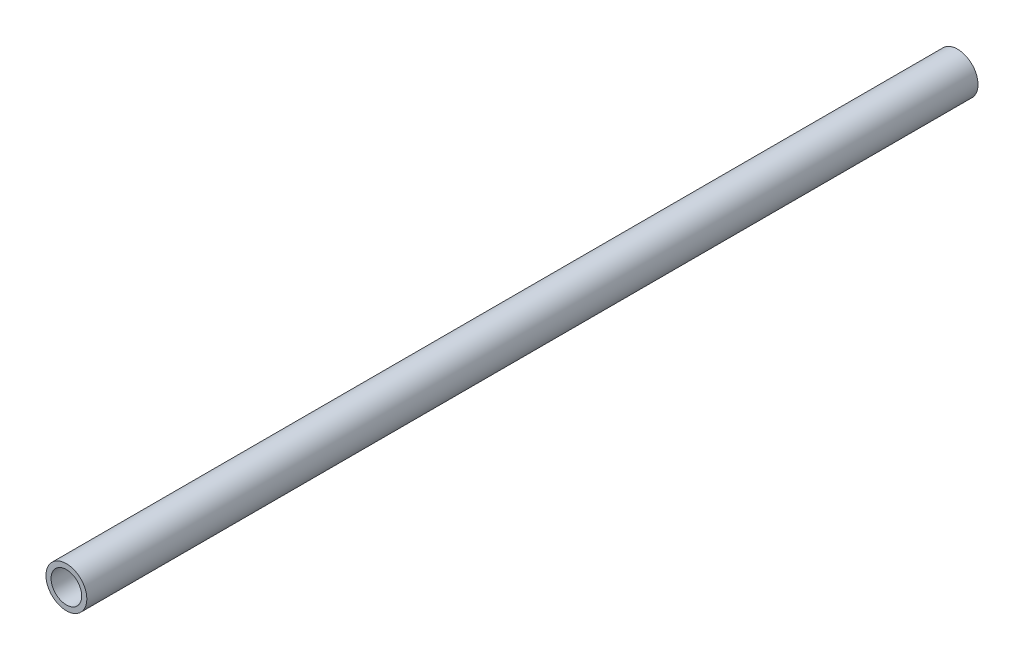
from build123d import *

# Parameters (mm, degrees)
SKETCH2_R           = 12.7
SKETCH2_R_2         = 9.525
BOSS_EXTRUDE1_DEPTH = 277.00605


with BuildPart() as part:
    # Sketch2 → Boss-Extrude1 (new, symmetric)
    with BuildSketch(Plane.XY):
        Circle(SKETCH2_R)
        Circle(SKETCH2_R_2, mode=Mode.SUBTRACT)
    extrude(amount=BOSS_EXTRUDE1_DEPTH, both=True)


solid = part.part
